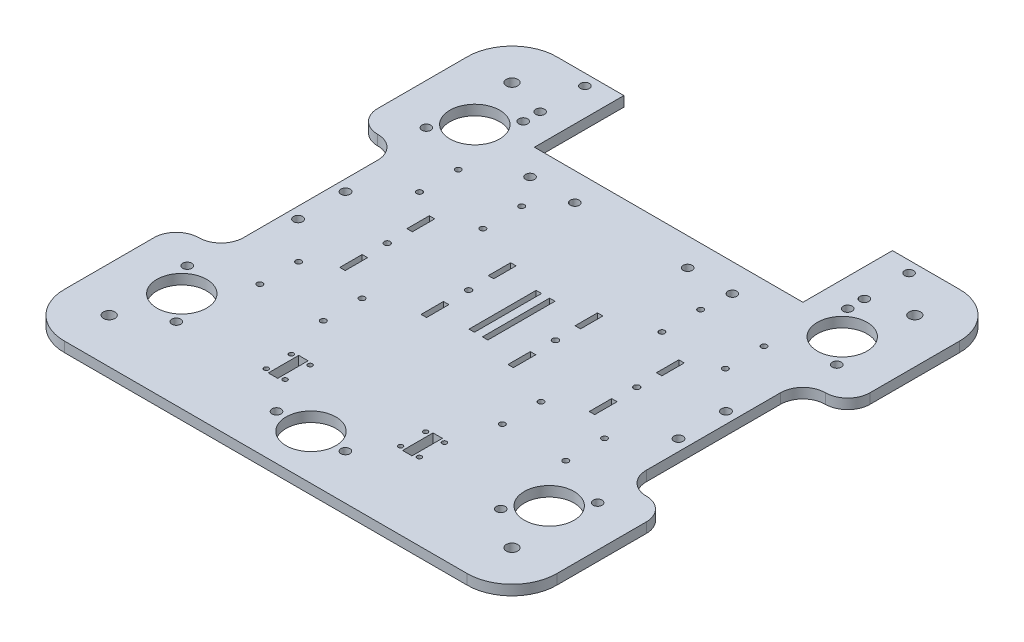
from build123d import *

# Parameters (mm, degrees)
SKETCH1_W                  = 279.4
SKETCH1_H                  = 279.4
BOSS_EXTRUDE1_DEPTH        = 5.715
CUT_EXTRUDE1_REACH         = 199.648
SKETCH2_R                  = 1.3
SKETCH2_W                  = 5.334
SKETCH2_H                  = 17.272
CUT_EXTRUDE2_REACH         = 199.648
SKETCH4_W                  = 25.4
SKETCH4_H                  = 101.6
FILLET1_START              = -1
FILLET1_DEPTH              = 8
FILLET1_2_DEPTH            = 5.715
CUT_EXTRUDE3_REACH         = 199.648
SKETCH5_W                  = 3.0988
SKETCH5_H                  = 12.7
CUT_EXTRUDE4_REACH         = 199.648
SKETCH6_R                  = 3.2639
FILLET2_R                  = 25.4
CUT_EXTRUDE5_REACH         = 199.648
SKETCH7_W                  = 152.4
SKETCH7_H                  = 50.8
F_6_0_204_DIAMETER_HOLE1_D = 5.1816
M3_CLEARANCE_HOLE1_D       = 3.4
CUT_EXTRUDE6_REACH         = 199.648
SKETCH15_R                 = 2.54
SKETCH15_R_2               = 14.1351
CUT_EXTRUDE7_REACH         = 199.648
SKETCH16_W                 = 3.0988
SKETCH16_H                 = 38.1
SKETCH19_R                 = 2.54
CUT_EXTRUDE8_DEPTH         = 198.648276555
SKETCH20_R                 = 1.60655
SKETCH20_R_2               = 1.59512
CUT_EXTRUDE9_DEPTH         = 198.648276555


with BuildPart() as part:
    # Sketch1 → Boss-Extrude1 (new body)
    with BuildSketch(Plane(origin=(0, 0, 0), x_dir=(1, 0, 0), z_dir=(0, 1, 0))):
        Rectangle(SKETCH1_W, SKETCH1_H)
    extrude(amount=BOSS_EXTRUDE1_DEPTH)

    # Sketch2 → Cut-Extrude1 (cut, up to next)
    with BuildSketch(Plane(origin=(0, 5.715, 0), x_dir=(1, 0, 0), z_dir=(0, 1, 0)), mode=Mode.PRIVATE) as cut_extrude1_sk1:
        with Locations(Location((-43.434, -81.788, 0), (0, 0, 270))):
            Circle(SKETCH2_R)
    cut_extrude1_tool1 = extrude(cut_extrude1_sk1.sketch, amount=-CUT_EXTRUDE1_REACH, mode=Mode.PRIVATE) & part.part
    # Sketch2 → Cut-Extrude1 (cut, up to next)
    with BuildSketch(Plane(origin=(0, 5.715, 0), x_dir=(1, 0, 0), z_dir=(0, 1, 0)), mode=Mode.PRIVATE) as cut_extrude1_sk2:
        with Locations(Location((-32.766, -81.788, 0), (0, 0, 270))):
            Circle(SKETCH2_R)
    cut_extrude1_tool2 = extrude(cut_extrude1_sk2.sketch, amount=-CUT_EXTRUDE1_REACH, mode=Mode.PRIVATE) & part.part
    # Sketch2 → Cut-Extrude1 (cut, up to next)
    with BuildSketch(Plane(origin=(0, 5.715, 0), x_dir=(1, 0, 0), z_dir=(0, 1, 0)), mode=Mode.PRIVATE) as cut_extrude1_sk3:
        with Locations(Location((-32.766, -96.012, 0), (0, 0, 270))):
            Circle(SKETCH2_R)
    cut_extrude1_tool3 = extrude(cut_extrude1_sk3.sketch, amount=-CUT_EXTRUDE1_REACH, mode=Mode.PRIVATE) & part.part
    # Sketch2 → Cut-Extrude1 (cut, up to next)
    with BuildSketch(Plane(origin=(0, 5.715, 0), x_dir=(1, 0, 0), z_dir=(0, 1, 0)), mode=Mode.PRIVATE) as cut_extrude1_sk4:
        with Locations(Location((-43.434, -96.012, 0), (0, 0, 270))):
            Circle(SKETCH2_R)
    cut_extrude1_tool4 = extrude(cut_extrude1_sk4.sketch, amount=-CUT_EXTRUDE1_REACH, mode=Mode.PRIVATE) & part.part
    # Sketch2 → Cut-Extrude1 (cut, up to next)
    with BuildSketch(Plane(origin=(0, 5.715, 0), x_dir=(1, 0, 0), z_dir=(0, 1, 0)), mode=Mode.PRIVATE) as cut_extrude1_sk5:
        with Locations(Location((43.434, -96.012, 0), (0, 0, 270))):
            Circle(SKETCH2_R)
    cut_extrude1_tool5 = extrude(cut_extrude1_sk5.sketch, amount=-CUT_EXTRUDE1_REACH, mode=Mode.PRIVATE) & part.part
    # Sketch2 → Cut-Extrude1 (cut, up to next)
    with BuildSketch(Plane(origin=(0, 5.715, 0), x_dir=(1, 0, 0), z_dir=(0, 1, 0)), mode=Mode.PRIVATE) as cut_extrude1_sk6:
        with Locations(Location((32.766, -96.012, 0), (0, 0, 270))):
            Circle(SKETCH2_R)
    cut_extrude1_tool6 = extrude(cut_extrude1_sk6.sketch, amount=-CUT_EXTRUDE1_REACH, mode=Mode.PRIVATE) & part.part
    # Sketch2 → Cut-Extrude1 (cut, up to next)
    with BuildSketch(Plane(origin=(0, 5.715, 0), x_dir=(1, 0, 0), z_dir=(0, 1, 0)), mode=Mode.PRIVATE) as cut_extrude1_sk7:
        with Locations(Location((32.766, -81.788, 0), (0, 0, 270))):
            Circle(SKETCH2_R)
    cut_extrude1_tool7 = extrude(cut_extrude1_sk7.sketch, amount=-CUT_EXTRUDE1_REACH, mode=Mode.PRIVATE) & part.part
    # Sketch2 → Cut-Extrude1 (cut, up to next)
    with BuildSketch(Plane(origin=(0, 5.715, 0), x_dir=(1, 0, 0), z_dir=(0, 1, 0)), mode=Mode.PRIVATE) as cut_extrude1_sk8:
        with Locations(Location((43.434, -81.788, 0), (0, 0, 270))):
            Circle(SKETCH2_R)
    cut_extrude1_tool8 = extrude(cut_extrude1_sk8.sketch, amount=-CUT_EXTRUDE1_REACH, mode=Mode.PRIVATE) & part.part
    # Sketch2 → Cut-Extrude1 (cut, up to next)
    with BuildSketch(Plane(origin=(0, 5.715, 0), x_dir=(1, 0, 0), z_dir=(0, 1, 0)), mode=Mode.PRIVATE) as cut_extrude1_sk9:
        with Locations((-38.1, -88.9)):
            Rectangle(SKETCH2_W, SKETCH2_H)
    cut_extrude1_tool9 = extrude(cut_extrude1_sk9.sketch, amount=-CUT_EXTRUDE1_REACH, mode=Mode.PRIVATE) & part.part
    # Sketch2 → Cut-Extrude1 (cut, up to next)
    with BuildSketch(Plane(origin=(0, 5.715, 0), x_dir=(1, 0, 0), z_dir=(0, 1, 0)), mode=Mode.PRIVATE) as cut_extrude1_sk10:
        with Locations((38.1, -88.9)):
            Rectangle(SKETCH2_W, SKETCH2_H)
    cut_extrude1_tool10 = extrude(cut_extrude1_sk10.sketch, amount=-CUT_EXTRUDE1_REACH, mode=Mode.PRIVATE) & part.part
    add(cut_extrude1_tool1.solids().sort_by_distance((-43.434, 5.715, 81.788))[0], mode=Mode.SUBTRACT)
    add(cut_extrude1_tool2.solids().sort_by_distance((-32.766, 5.715, 81.788))[0], mode=Mode.SUBTRACT)
    add(cut_extrude1_tool3.solids().sort_by_distance((-32.766, 5.715, 96.012))[0], mode=Mode.SUBTRACT)
    add(cut_extrude1_tool4.solids().sort_by_distance((-43.434, 5.715, 96.012))[0], mode=Mode.SUBTRACT)
    add(cut_extrude1_tool5.solids().sort_by_distance((43.434, 5.715, 96.012))[0], mode=Mode.SUBTRACT)
    add(cut_extrude1_tool6.solids().sort_by_distance((32.766, 5.715, 96.012))[0], mode=Mode.SUBTRACT)
    add(cut_extrude1_tool7.solids().sort_by_distance((32.766, 5.715, 81.788))[0], mode=Mode.SUBTRACT)
    add(cut_extrude1_tool8.solids().sort_by_distance((43.434, 5.715, 81.788))[0], mode=Mode.SUBTRACT)
    add(cut_extrude1_tool9.solids().sort_by_distance((-38.1, 5.715, 88.9))[0], mode=Mode.SUBTRACT)
    add(cut_extrude1_tool10.solids().sort_by_distance((38.1, 5.715, 88.9))[0], mode=Mode.SUBTRACT)

    # Sketch4 → Cut-Extrude2 (cut, up to next)
    with BuildSketch(Plane(origin=(0, 5.715, 0), x_dir=(1, 0, 0), z_dir=(0, 1, 0)), mode=Mode.PRIVATE) as cut_extrude2_sk1:
        with Locations((-127, 0)):
            Rectangle(SKETCH4_W, SKETCH4_H)
    cut_extrude2_tool1 = extrude(cut_extrude2_sk1.sketch, amount=-CUT_EXTRUDE2_REACH, mode=Mode.PRIVATE) & part.part
    # Sketch4 → Cut-Extrude2 (cut, up to next)
    with BuildSketch(Plane(origin=(0, 5.715, 0), x_dir=(1, 0, 0), z_dir=(0, 1, 0)), mode=Mode.PRIVATE) as cut_extrude2_sk2:
        with Locations((127, 0)):
            Rectangle(SKETCH4_W, SKETCH4_H)
    cut_extrude2_tool2 = extrude(cut_extrude2_sk2.sketch, amount=-CUT_EXTRUDE2_REACH, mode=Mode.PRIVATE) & part.part
    add(cut_extrude2_tool1.solids().sort_by_distance((-127, 5.715, 0))[0], mode=Mode.SUBTRACT)
    add(cut_extrude2_tool2.solids().sort_by_distance((127, 5.715, 0))[0], mode=Mode.SUBTRACT)

    # Fillet1: read off the stored shape, not the designer's step
    # Fillet1 outline → Fillet1 (cut)
    with BuildSketch(Plane(origin=(0, 0, 0), x_dir=(1, 0, 0), z_dir=(0, 1, 0)).offset(FILLET1_START)):
        with BuildLine():
            Line((139.7, -50.8), (127, -50.8))
            ThreePointArc((127, -50.8), (135.980256121, -54.519743879), (139.7, -63.5))
            Line((139.7, -63.5), (139.7, -50.8))
        make_face()
        with BuildLine():
            ThreePointArc((139.7, 63.5), (135.980256121, 54.519743879), (127, 50.8))
            Line((127, 50.8), (139.7, 50.8))
            Line((139.7, 50.8), (139.7, 63.5))
        make_face()
        with BuildLine():
            Line((-139.7, 50.8), (-127, 50.8))
            ThreePointArc((-127, 50.8), (-135.980256121, 54.519743879), (-139.7, 63.5))
            Line((-139.7, 63.5), (-139.7, 50.8))
        make_face()
        with BuildLine():
            ThreePointArc((-139.7, -63.5), (-135.980256121, -54.519743879), (-127, -50.8))
            Line((-127, -50.8), (-139.7, -50.8))
            Line((-139.7, -50.8), (-139.7, -63.5))
        make_face()
    extrude(amount=FILLET1_DEPTH, mode=Mode.SUBTRACT)

    # Fillet1 2 outline → Fillet1 2 (add)
    with BuildSketch(Plane(origin=(0, 0, 0), x_dir=(1, 0, 0), z_dir=(0, 1, 0))):
        with BuildLine():
            Line((114.3, -50.8), (127, -50.8))
            ThreePointArc((127, -50.8), (118.019743879, -47.080256121), (114.3, -38.1))
            Line((114.3, -38.1), (114.3, -50.8))
        make_face()
        with BuildLine():
            Line((114.3, 50.8), (114.3, 38.1))
            ThreePointArc((114.3, 38.1), (118.019743879, 47.080256121), (127, 50.8))
            Line((127, 50.8), (114.3, 50.8))
        make_face()
        with BuildLine():
            ThreePointArc((-127, 50.8), (-118.019743879, 47.080256121), (-114.3, 38.1))
            Line((-114.3, 38.1), (-114.3, 50.8))
            Line((-114.3, 50.8), (-127, 50.8))
        make_face()
        with BuildLine():
            ThreePointArc((-114.3, -38.1), (-118.019743879, -47.080256121), (-127, -50.8))
            Line((-127, -50.8), (-114.3, -50.8))
            Line((-114.3, -50.8), (-114.3, -38.1))
        make_face()
    extrude(amount=FILLET1_2_DEPTH)

    # Sketch5 → Cut-Extrude3 (cut, up to next)
    with BuildSketch(Plane(origin=(0, 0, 0), x_dir=(-1, 0, 0), z_dir=(0, -1, 0)), mode=Mode.PRIVATE) as cut_extrude3_sk1:
        with Locations((70.8025, -19.05)):
            Rectangle(SKETCH5_W, SKETCH5_H)
    cut_extrude3_tool1 = extrude(cut_extrude3_sk1.sketch, amount=-CUT_EXTRUDE3_REACH, mode=Mode.PRIVATE) & part.part
    # Sketch5 → Cut-Extrude3 (cut, up to next)
    with BuildSketch(Plane(origin=(0, 0, 0), x_dir=(-1, 0, 0), z_dir=(0, -1, 0)), mode=Mode.PRIVATE) as cut_extrude3_sk2:
        with Locations((70.8025, 19.05)):
            Rectangle(SKETCH5_W, SKETCH5_H)
    cut_extrude3_tool2 = extrude(cut_extrude3_sk2.sketch, amount=-CUT_EXTRUDE3_REACH, mode=Mode.PRIVATE) & part.part
    # Sketch5 → Cut-Extrude3 (cut, up to next)
    with BuildSketch(Plane(origin=(0, 0, 0), x_dir=(-1, 0, 0), z_dir=(0, -1, 0)), mode=Mode.PRIVATE) as cut_extrude3_sk3:
        with Locations((-70.8025, 19.05)):
            Rectangle(SKETCH5_W, SKETCH5_H)
    cut_extrude3_tool3 = extrude(cut_extrude3_sk3.sketch, amount=-CUT_EXTRUDE3_REACH, mode=Mode.PRIVATE) & part.part
    # Sketch5 → Cut-Extrude3 (cut, up to next)
    with BuildSketch(Plane(origin=(0, 0, 0), x_dir=(-1, 0, 0), z_dir=(0, -1, 0)), mode=Mode.PRIVATE) as cut_extrude3_sk4:
        with Locations((-70.8025, -19.05)):
            Rectangle(SKETCH5_W, SKETCH5_H)
    cut_extrude3_tool4 = extrude(cut_extrude3_sk4.sketch, amount=-CUT_EXTRUDE3_REACH, mode=Mode.PRIVATE) & part.part
    # Sketch5 → Cut-Extrude3 (cut, up to next)
    with BuildSketch(Plane(origin=(0, 0, 0), x_dir=(-1, 0, 0), z_dir=(0, -1, 0)), mode=Mode.PRIVATE) as cut_extrude3_sk5:
        with Locations((24.638, -19.05)):
            Rectangle(SKETCH5_W, SKETCH5_H)
    cut_extrude3_tool5 = extrude(cut_extrude3_sk5.sketch, amount=-CUT_EXTRUDE3_REACH, mode=Mode.PRIVATE) & part.part
    # Sketch5 → Cut-Extrude3 (cut, up to next)
    with BuildSketch(Plane(origin=(0, 0, 0), x_dir=(-1, 0, 0), z_dir=(0, -1, 0)), mode=Mode.PRIVATE) as cut_extrude3_sk6:
        with Locations((24.638, 19.05)):
            Rectangle(SKETCH5_W, SKETCH5_H)
    cut_extrude3_tool6 = extrude(cut_extrude3_sk6.sketch, amount=-CUT_EXTRUDE3_REACH, mode=Mode.PRIVATE) & part.part
    # Sketch5 → Cut-Extrude3 (cut, up to next)
    with BuildSketch(Plane(origin=(0, 0, 0), x_dir=(-1, 0, 0), z_dir=(0, -1, 0)), mode=Mode.PRIVATE) as cut_extrude3_sk7:
        with Locations((-24.638, 19.05)):
            Rectangle(SKETCH5_W, SKETCH5_H)
    cut_extrude3_tool7 = extrude(cut_extrude3_sk7.sketch, amount=-CUT_EXTRUDE3_REACH, mode=Mode.PRIVATE) & part.part
    # Sketch5 → Cut-Extrude3 (cut, up to next)
    with BuildSketch(Plane(origin=(0, 0, 0), x_dir=(-1, 0, 0), z_dir=(0, -1, 0)), mode=Mode.PRIVATE) as cut_extrude3_sk8:
        with Locations((-24.638, -19.05)):
            Rectangle(SKETCH5_W, SKETCH5_H)
    cut_extrude3_tool8 = extrude(cut_extrude3_sk8.sketch, amount=-CUT_EXTRUDE3_REACH, mode=Mode.PRIVATE) & part.part
    add(cut_extrude3_tool1.solids().sort_by_distance((-70.8025, 0, 19.05))[0], mode=Mode.SUBTRACT)
    add(cut_extrude3_tool2.solids().sort_by_distance((-70.8025, 0, -19.05))[0], mode=Mode.SUBTRACT)
    add(cut_extrude3_tool3.solids().sort_by_distance((70.8025, 0, -19.05))[0], mode=Mode.SUBTRACT)
    add(cut_extrude3_tool4.solids().sort_by_distance((70.8025, 0, 19.05))[0], mode=Mode.SUBTRACT)
    add(cut_extrude3_tool5.solids().sort_by_distance((-24.638, 0, 19.05))[0], mode=Mode.SUBTRACT)
    add(cut_extrude3_tool6.solids().sort_by_distance((-24.638, 0, -19.05))[0], mode=Mode.SUBTRACT)
    add(cut_extrude3_tool7.solids().sort_by_distance((24.638, 0, -19.05))[0], mode=Mode.SUBTRACT)
    add(cut_extrude3_tool8.solids().sort_by_distance((24.638, 0, 19.05))[0], mode=Mode.SUBTRACT)

    # Sketch6 → Cut-Extrude4 (cut, up to next)
    with BuildSketch(Plane(origin=(0, 5.715, 0), x_dir=(1, 0, 0), z_dir=(0, 1, 0)), mode=Mode.PRIVATE) as cut_extrude4_sk1:
        with Locations(Location((-114.3, 114.3, 0), (0, 0, 270))):
            Circle(SKETCH6_R)
    cut_extrude4_tool1 = extrude(cut_extrude4_sk1.sketch, amount=-CUT_EXTRUDE4_REACH, mode=Mode.PRIVATE) & part.part
    # Sketch6 → Cut-Extrude4 (cut, up to next)
    with BuildSketch(Plane(origin=(0, 5.715, 0), x_dir=(1, 0, 0), z_dir=(0, 1, 0)), mode=Mode.PRIVATE) as cut_extrude4_sk2:
        with Locations(Location((114.3, 114.3, 0), (0, 0, 270))):
            Circle(SKETCH6_R)
    cut_extrude4_tool2 = extrude(cut_extrude4_sk2.sketch, amount=-CUT_EXTRUDE4_REACH, mode=Mode.PRIVATE) & part.part
    # Sketch6 → Cut-Extrude4 (cut, up to next)
    with BuildSketch(Plane(origin=(0, 5.715, 0), x_dir=(1, 0, 0), z_dir=(0, 1, 0)), mode=Mode.PRIVATE) as cut_extrude4_sk3:
        with Locations(Location((114.3, -114.3, 0), (0, 0, 270))):
            Circle(SKETCH6_R)
    cut_extrude4_tool3 = extrude(cut_extrude4_sk3.sketch, amount=-CUT_EXTRUDE4_REACH, mode=Mode.PRIVATE) & part.part
    # Sketch6 → Cut-Extrude4 (cut, up to next)
    with BuildSketch(Plane(origin=(0, 5.715, 0), x_dir=(1, 0, 0), z_dir=(0, 1, 0)), mode=Mode.PRIVATE) as cut_extrude4_sk4:
        with Locations(Location((-114.3, -114.3, 0), (0, 0, 270))):
            Circle(SKETCH6_R)
    cut_extrude4_tool4 = extrude(cut_extrude4_sk4.sketch, amount=-CUT_EXTRUDE4_REACH, mode=Mode.PRIVATE) & part.part
    add(cut_extrude4_tool1.solids().sort_by_distance((-114.3, 5.715, -114.3))[0], mode=Mode.SUBTRACT)
    add(cut_extrude4_tool2.solids().sort_by_distance((114.3, 5.715, -114.3))[0], mode=Mode.SUBTRACT)
    add(cut_extrude4_tool3.solids().sort_by_distance((114.3, 5.715, 114.3))[0], mode=Mode.SUBTRACT)
    add(cut_extrude4_tool4.solids().sort_by_distance((-114.3, 5.715, 114.3))[0], mode=Mode.SUBTRACT)

    # Fillet2
    fillet2_edges = [part.edges().sort_by_distance(p)[0] for p in [
        (-139.7, 2.8575, -139.7),
        (139.7, 2.8575, -139.7),
        (139.7, 2.8575, 139.7),
        (-139.7, 2.8575, 139.7),
    ]]
    fillet(fillet2_edges, radius=FILLET2_R)

    # Sketch7 → Cut-Extrude5 (cut, up to next)
    with BuildSketch(Plane(origin=(0, 5.715, 0), x_dir=(1, 0, 0), z_dir=(0, 1, 0)), mode=Mode.PRIVATE) as cut_extrude5_sk1:
        with Locations((0, 114.3)):
            Rectangle(SKETCH7_W, SKETCH7_H)
    cut_extrude5_tool1 = extrude(cut_extrude5_sk1.sketch, amount=-CUT_EXTRUDE5_REACH, mode=Mode.PRIVATE) & part.part
    add(cut_extrude5_tool1.solids().sort_by_distance((0, 5.715, -114.3))[0], mode=Mode.SUBTRACT)

    # #6 (0.204) Diameter Hole1 (through all)
    with Locations(Plane(origin=(0, 5.715, 0), x_dir=(1, 0, 0), z_dir=(0, 1, 0))):
        with Locations((-107.95, 13.462), (-107.95, -13.462), (107.95, 13.462), (107.95, -13.462)):
            Hole(F_6_0_204_DIAMETER_HOLE1_D / 2)

    # M3 Clearance Hole1 (through all)
    with Locations(Plane(origin=(0, 5.715, 0), x_dir=(1, 0, 0), z_dir=(0, 1, 0))):
        with Locations((-70.8025, 0), (-199.325034329, 13.763566923), (-305.450768013, 71.515798388), (24.638, 0), (-24.638, 0), (70.8025, 0)):
            Hole(M3_CLEARANCE_HOLE1_D / 2)

    # Sketch15 → Cut-Extrude6 (cut, up to next)
    with BuildSketch(Plane(origin=(0, 5.715, 0), x_dir=(1, 0, 0), z_dir=(0, 1, 0)), mode=Mode.PRIVATE) as cut_extrude6_sk1:
        with Locations(Location((-116.451441732, -67.851304944, 0), (0, 0, 270))):
            Circle(SKETCH15_R)
    cut_extrude6_tool1 = extrude(cut_extrude6_sk1.sketch, amount=-CUT_EXTRUDE6_REACH, mode=Mode.PRIVATE) & part.part
    # Sketch15 → Cut-Extrude6 (cut, up to next)
    with BuildSketch(Plane(origin=(0, 5.715, 0), x_dir=(1, 0, 0), z_dir=(0, 1, 0)), mode=Mode.PRIVATE) as cut_extrude6_sk2:
        with Locations(Location((-104.257228187, -83.142365078, 0), (0, 0, 270))):
            Circle(SKETCH15_R_2)
    cut_extrude6_tool2 = extrude(cut_extrude6_sk2.sketch, amount=-CUT_EXTRUDE6_REACH, mode=Mode.PRIVATE) & part.part
    # Sketch15 → Cut-Extrude6 (cut, up to next)
    with BuildSketch(Plane(origin=(0, 5.715, 0), x_dir=(1, 0, 0), z_dir=(0, 1, 0)), mode=Mode.PRIVATE) as cut_extrude6_sk3:
        with Locations(Location((-92.063014642, -98.433425212, 0), (0, 0, 270))):
            Circle(SKETCH15_R)
    cut_extrude6_tool3 = extrude(cut_extrude6_sk3.sketch, amount=-CUT_EXTRUDE6_REACH, mode=Mode.PRIVATE) & part.part
    # Sketch15 → Cut-Extrude6 (cut, up to next)
    with BuildSketch(Plane(origin=(0, 5.715, 0), x_dir=(1, 0, 0), z_dir=(0, 1, 0)), mode=Mode.PRIVATE) as cut_extrude6_sk4:
        with Locations(Location((-92.063014642, 98.433425212, 0), (0, 0, 270))):
            Circle(SKETCH15_R)
    cut_extrude6_tool4 = extrude(cut_extrude6_sk4.sketch, amount=-CUT_EXTRUDE6_REACH, mode=Mode.PRIVATE) & part.part
    # Sketch15 → Cut-Extrude6 (cut, up to next)
    with BuildSketch(Plane(origin=(0, 5.715, 0), x_dir=(1, 0, 0), z_dir=(0, 1, 0)), mode=Mode.PRIVATE) as cut_extrude6_sk5:
        with Locations(Location((-104.257228187, 83.142365078, 0), (0, 0, 270))):
            Circle(SKETCH15_R_2)
    cut_extrude6_tool5 = extrude(cut_extrude6_sk5.sketch, amount=-CUT_EXTRUDE6_REACH, mode=Mode.PRIVATE) & part.part
    # Sketch15 → Cut-Extrude6 (cut, up to next)
    with BuildSketch(Plane(origin=(0, 5.715, 0), x_dir=(1, 0, 0), z_dir=(0, 1, 0)), mode=Mode.PRIVATE) as cut_extrude6_sk6:
        with Locations(Location((-116.451441732, 67.851304944, 0), (0, 0, 270))):
            Circle(SKETCH15_R)
    cut_extrude6_tool6 = extrude(cut_extrude6_sk6.sketch, amount=-CUT_EXTRUDE6_REACH, mode=Mode.PRIVATE) & part.part
    # Sketch15 → Cut-Extrude6 (cut, up to next)
    with BuildSketch(Plane(origin=(0, 5.715, 0), x_dir=(1, 0, 0), z_dir=(0, 1, 0)), mode=Mode.PRIVATE) as cut_extrude6_sk7:
        with Locations(Location((116.451441732, 67.851304944, 0), (0, 0, 270))):
            Circle(SKETCH15_R)
    cut_extrude6_tool7 = extrude(cut_extrude6_sk7.sketch, amount=-CUT_EXTRUDE6_REACH, mode=Mode.PRIVATE) & part.part
    # Sketch15 → Cut-Extrude6 (cut, up to next)
    with BuildSketch(Plane(origin=(0, 5.715, 0), x_dir=(1, 0, 0), z_dir=(0, 1, 0)), mode=Mode.PRIVATE) as cut_extrude6_sk8:
        with Locations(Location((104.257228187, 83.142365078, 0), (0, 0, 270))):
            Circle(SKETCH15_R_2)
    cut_extrude6_tool8 = extrude(cut_extrude6_sk8.sketch, amount=-CUT_EXTRUDE6_REACH, mode=Mode.PRIVATE) & part.part
    # Sketch15 → Cut-Extrude6 (cut, up to next)
    with BuildSketch(Plane(origin=(0, 5.715, 0), x_dir=(1, 0, 0), z_dir=(0, 1, 0)), mode=Mode.PRIVATE) as cut_extrude6_sk9:
        with Locations(Location((92.063014642, 98.433425212, 0), (0, 0, 270))):
            Circle(SKETCH15_R)
    cut_extrude6_tool9 = extrude(cut_extrude6_sk9.sketch, amount=-CUT_EXTRUDE6_REACH, mode=Mode.PRIVATE) & part.part
    # Sketch15 → Cut-Extrude6 (cut, up to next)
    with BuildSketch(Plane(origin=(0, 5.715, 0), x_dir=(1, 0, 0), z_dir=(0, 1, 0)), mode=Mode.PRIVATE) as cut_extrude6_sk10:
        with Locations(Location((92.063014642, -98.433425212, 0), (0, 0, 270))):
            Circle(SKETCH15_R)
    cut_extrude6_tool10 = extrude(cut_extrude6_sk10.sketch, amount=-CUT_EXTRUDE6_REACH, mode=Mode.PRIVATE) & part.part
    # Sketch15 → Cut-Extrude6 (cut, up to next)
    with BuildSketch(Plane(origin=(0, 5.715, 0), x_dir=(1, 0, 0), z_dir=(0, 1, 0)), mode=Mode.PRIVATE) as cut_extrude6_sk11:
        with Locations(Location((104.257228187, -83.142365078, 0), (0, 0, 270))):
            Circle(SKETCH15_R_2)
    cut_extrude6_tool11 = extrude(cut_extrude6_sk11.sketch, amount=-CUT_EXTRUDE6_REACH, mode=Mode.PRIVATE) & part.part
    # Sketch15 → Cut-Extrude6 (cut, up to next)
    with BuildSketch(Plane(origin=(0, 5.715, 0), x_dir=(1, 0, 0), z_dir=(0, 1, 0)), mode=Mode.PRIVATE) as cut_extrude6_sk12:
        with Locations(Location((116.451441732, -67.851304944, 0), (0, 0, 270))):
            Circle(SKETCH15_R)
    cut_extrude6_tool12 = extrude(cut_extrude6_sk12.sketch, amount=-CUT_EXTRUDE6_REACH, mode=Mode.PRIVATE) & part.part
    # Sketch15 → Cut-Extrude6 (cut, up to next)
    with BuildSketch(Plane(origin=(0, 5.715, 0), x_dir=(1, 0, 0), z_dir=(0, 1, 0)), mode=Mode.PRIVATE) as cut_extrude6_sk13:
        with Locations(Location((-19.558, -114.092780833, 0), (0, 0, 270))):
            Circle(SKETCH15_R)
    cut_extrude6_tool13 = extrude(cut_extrude6_sk13.sketch, amount=-CUT_EXTRUDE6_REACH, mode=Mode.PRIVATE) & part.part
    # Sketch15 → Cut-Extrude6 (cut, up to next)
    with BuildSketch(Plane(origin=(0, 5.715, 0), x_dir=(1, 0, 0), z_dir=(0, 1, 0)), mode=Mode.PRIVATE) as cut_extrude6_sk14:
        with Locations(Location((19.558, -114.092780833, 0), (0, 0, 270))):
            Circle(SKETCH15_R)
    cut_extrude6_tool14 = extrude(cut_extrude6_sk14.sketch, amount=-CUT_EXTRUDE6_REACH, mode=Mode.PRIVATE) & part.part
    # Sketch15 → Cut-Extrude6 (cut, up to next)
    with BuildSketch(Plane(origin=(0, 5.715, 0), x_dir=(1, 0, 0), z_dir=(0, 1, 0)), mode=Mode.PRIVATE) as cut_extrude6_sk15:
        with Locations(Location((0, -114.092780833, 0), (0, 0, 270))):
            Circle(SKETCH15_R_2)
    cut_extrude6_tool15 = extrude(cut_extrude6_sk15.sketch, amount=-CUT_EXTRUDE6_REACH, mode=Mode.PRIVATE) & part.part
    add(cut_extrude6_tool1.solids().sort_by_distance((-116.451442, 5.715, 67.851305))[0], mode=Mode.SUBTRACT)
    add(cut_extrude6_tool2.solids().sort_by_distance((-104.257228, 5.715, 83.142365))[0], mode=Mode.SUBTRACT)
    add(cut_extrude6_tool3.solids().sort_by_distance((-92.063015, 5.715, 98.433425))[0], mode=Mode.SUBTRACT)
    add(cut_extrude6_tool4.solids().sort_by_distance((-92.063015, 5.715, -98.433425))[0], mode=Mode.SUBTRACT)
    add(cut_extrude6_tool5.solids().sort_by_distance((-104.257228, 5.715, -83.142365))[0], mode=Mode.SUBTRACT)
    add(cut_extrude6_tool6.solids().sort_by_distance((-116.451442, 5.715, -67.851305))[0], mode=Mode.SUBTRACT)
    add(cut_extrude6_tool7.solids().sort_by_distance((116.451442, 5.715, -67.851305))[0], mode=Mode.SUBTRACT)
    add(cut_extrude6_tool8.solids().sort_by_distance((104.257228, 5.715, -83.142365))[0], mode=Mode.SUBTRACT)
    add(cut_extrude6_tool9.solids().sort_by_distance((92.063015, 5.715, -98.433425))[0], mode=Mode.SUBTRACT)
    add(cut_extrude6_tool10.solids().sort_by_distance((92.063015, 5.715, 98.433425))[0], mode=Mode.SUBTRACT)
    add(cut_extrude6_tool11.solids().sort_by_distance((104.257228, 5.715, 83.142365))[0], mode=Mode.SUBTRACT)
    add(cut_extrude6_tool12.solids().sort_by_distance((116.451442, 5.715, 67.851305))[0], mode=Mode.SUBTRACT)
    add(cut_extrude6_tool13.solids().sort_by_distance((-19.558, 5.715, 114.092781))[0], mode=Mode.SUBTRACT)
    add(cut_extrude6_tool14.solids().sort_by_distance((19.558, 5.715, 114.092781))[0], mode=Mode.SUBTRACT)
    add(cut_extrude6_tool15.solids().sort_by_distance((0, 5.715, 114.092781))[0], mode=Mode.SUBTRACT)

    # Sketch16 → Cut-Extrude7 (cut, up to next)
    with BuildSketch(Plane(origin=(0, 5.715, 0), x_dir=(1, 0, 0), z_dir=(0, 1, 0)), mode=Mode.PRIVATE) as cut_extrude7_sk1:
        with Locations((-3.81, 0)):
            Rectangle(SKETCH16_W, SKETCH16_H)
    cut_extrude7_tool1 = extrude(cut_extrude7_sk1.sketch, amount=-CUT_EXTRUDE7_REACH, mode=Mode.PRIVATE) & part.part
    # Sketch16 → Cut-Extrude7 (cut, up to next)
    with BuildSketch(Plane(origin=(0, 5.715, 0), x_dir=(1, 0, 0), z_dir=(0, 1, 0)), mode=Mode.PRIVATE) as cut_extrude7_sk2:
        with Locations((3.81, 0)):
            Rectangle(SKETCH16_W, SKETCH16_H)
    cut_extrude7_tool2 = extrude(cut_extrude7_sk2.sketch, amount=-CUT_EXTRUDE7_REACH, mode=Mode.PRIVATE) & part.part
    add(cut_extrude7_tool1.solids().sort_by_distance((-3.81, 5.715, 0))[0], mode=Mode.SUBTRACT)
    add(cut_extrude7_tool2.solids().sort_by_distance((3.81, 5.715, 0))[0], mode=Mode.SUBTRACT)

    # Sketch19 → Cut-Extrude8 (cut, through all)
    with BuildSketch(Plane(origin=(0, 0, 0), x_dir=(1, 0, 0), z_dir=(0, 1, 0))):
        with Locations(Location((-62.858035503, 73.1012, 0), (0, 0, 270))):
            Circle(SKETCH19_R)
        with Locations(Location((-37.458035503, 73.1012, 0), (0, 0, 270))):
            Circle(SKETCH19_R)
        with Locations(Location((26.578461241, 73.1012, 0), (0, 0, 270))):
            Circle(SKETCH19_R)
        with Locations(Location((51.978461241, 73.1012, 0), (0, 0, 270))):
            Circle(SKETCH19_R)
        with Locations(Location((91.9988, 133.35, 0), (0, 0, 270))):
            Circle(SKETCH19_R)
        with Locations(Location((91.9988, 107.95, 0), (0, 0, 270))):
            Circle(SKETCH19_R)
        with Locations(Location((-91.9988, 107.95, 0), (0, 0, 90))):
            Circle(SKETCH19_R)
        with Locations(Location((-91.9988, 133.35, 0), (0, 0, 90))):
            Circle(SKETCH19_R)
    extrude(amount=CUT_EXTRUDE8_DEPTH, mode=Mode.SUBTRACT)

    # Sketch20 → Cut-Extrude9 (cut, through all)
    with BuildSketch(Plane(origin=(0, 5.715, 0), x_dir=(1, 0, 0), z_dir=(0, 1, 0))):
        with Locations(Location((-86.7918, 56.2864, 0), (0, 0, 270))):
            Circle(SKETCH20_R)
        with Locations(Location((-50.8, 56.2864, 0), (0, 0, 270))):
            Circle(SKETCH20_R)
        with Locations(Location((-50.8, 34.29, 0), (0, 0, 270))):
            Circle(SKETCH20_R_2)
        with Locations(Location((-86.7918, 34.29, 0), (0, 0, 270))):
            Circle(SKETCH20_R)
        with Locations(Location((86.7918, 34.29, 0), (0, 0, 90))):
            Circle(SKETCH20_R)
        with Locations(Location((50.8, 34.29, 0), (0, 0, 90))):
            Circle(SKETCH20_R_2)
        with Locations(Location((50.8, 56.2864, 0), (0, 0, 90))):
            Circle(SKETCH20_R)
        with Locations(Location((86.7918, 56.2864, 0), (0, 0, 90))):
            Circle(SKETCH20_R)
        with Locations(Location((86.7918, -56.2864, 0), (0, 0, 270))):
            Circle(SKETCH20_R)
        with Locations(Location((50.8, -56.2864, 0), (0, 0, 270))):
            Circle(SKETCH20_R)
        with Locations(Location((50.8, -34.29, 0), (0, 0, 270))):
            Circle(SKETCH20_R_2)
        with Locations(Location((86.7918, -34.29, 0), (0, 0, 270))):
            Circle(SKETCH20_R)
        with Locations(Location((-86.7918, -34.29, 0), (0, 0, 90))):
            Circle(SKETCH20_R)
        with Locations(Location((-50.8, -34.29, 0), (0, 0, 90))):
            Circle(SKETCH20_R_2)
        with Locations(Location((-50.8, -56.2864, 0), (0, 0, 90))):
            Circle(SKETCH20_R)
        with Locations(Location((-86.7918, -56.2864, 0), (0, 0, 90))):
            Circle(SKETCH20_R)
    extrude(amount=-CUT_EXTRUDE9_DEPTH, mode=Mode.SUBTRACT)


solid = part.part
